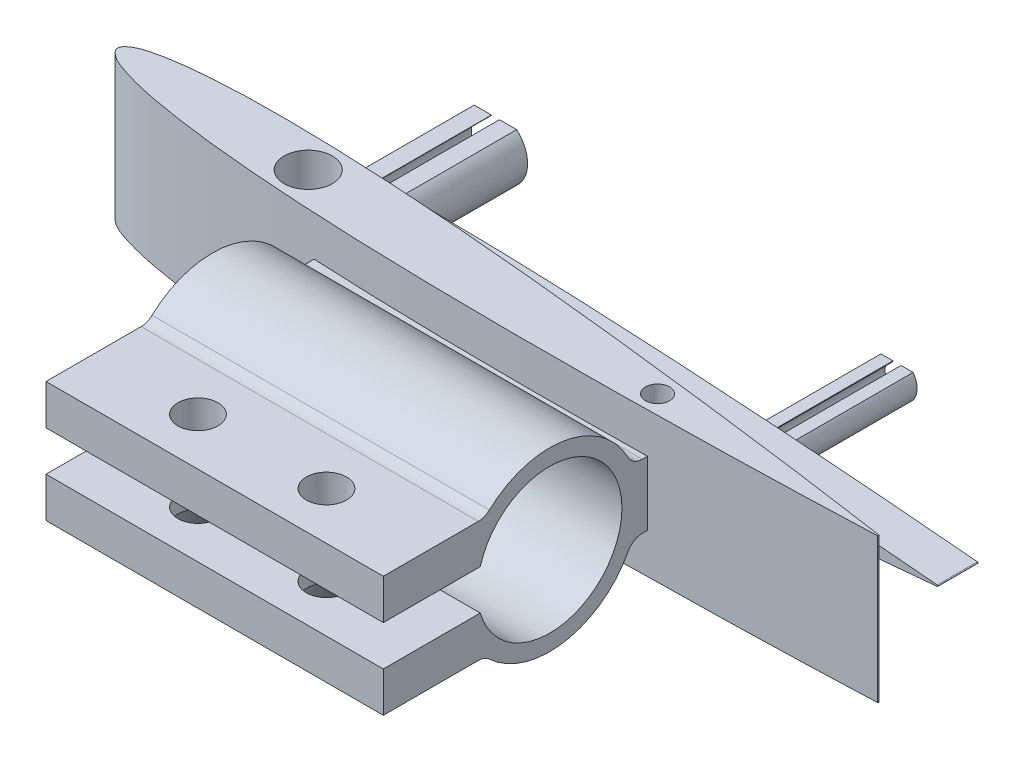
from build123d import *
from build123d.topology import SkipClean

# Parameters (mm, degrees)
CORPOCENTINA_DEPTH             = 5
SCHIZZO2_R                     = 3
FOROLONGHERONE_DEPTH           = 101.288658798
AGGANCIOPERNO_DEPTH            = 15
AGGANCIOLONGHERONE_DEPTH       = 15
AGGANCIOTUBOMOTORE_DEPTH       = 42
RACCORDIAGGANCIOTUBOMOTORE_R   = 2
SCHIZZO7_R                     = 3
CHIUSURAFOROLONGHERONE_DEPTH   = 5
CENTINAORIZZONTALE_DEPTH       = 9
CENTINAORIZZONTALE_DEPTH_BACK  = 9
CHIUSURACENTINAVERTICALE_DEPTH = 2.000000405
SCHIZZO11_R                    = 3
SCHIZZO11_R_2                  = 1.5
FORICENTINAORIZZONTALE_DEPTH   = 18
SCHIZZO13_R                    = 2.5
FORIVITIBASE_DEPTH             = 112.675114745


with BuildPart() as part:
    # Schizzo1 → CorpoCentina (new body)
    with BuildSketch(Plane.XY):
        with BuildLine():
            ThreePointArc((100, 0.084), (100.084, 0), (100, -0.084))
            add(Edge.make_bspline(
                [(100, 0.084), (98.333488815, 0.23674648), (95.001194725, 0.542172689), (88.335559621, 1.11089898), (80.003293356, 1.763610995), (70.002998933, 2.457861693), (60.003104625, 3.061747723), (50.003008601, 3.552139212), (40.002598558, 3.902946494), (31.666961486, 4.025260151), (24.9991546, 3.976933791), (19.997775587, 3.844976398), (14.993363131, 3.592486959), (10.827184065, 3.237651579), (7.489054388, 2.814021367), (4.99359465, 2.403673059), (2.84962634, 1.867925494), (1.165413503, 1.320987252), (-0.664613784, 0), (1.165413503, -1.320987252), (2.84962634, -1.867925494), (4.99359465, -2.403673059), (7.489054388, -2.814021367), (10.827184065, -3.237651579), (14.993363131, -3.592486959), (19.997775587, -3.844976398), (24.9991546, -3.976933791), (31.666961486, -4.025260151), (40.002598558, -3.902946494), (50.003008601, -3.552139212), (60.003104625, -3.061747723), (70.002998933, -2.457861693), (80.003293356, -1.763610995), (88.335559621, -1.11089898), (95.001194725, -0.542172689), (98.333488815, -0.23674648), (100, -0.084)],
                knots=[0, 0, 0, 0, 0.024876293, 0.049741715, 0.099443402, 0.149112224, 0.198750974, 0.248359097, 0.29793737, 0.347491327, 0.37226694, 0.397050924, 0.421859475, 0.446731346, 0.459220451, 0.471790602, 0.484560454, 0.491195112, 0.5, 0.508804888, 0.515439546, 0.528209398, 0.540779549, 0.553268654, 0.578140525, 0.602949076, 0.62773306, 0.652508673, 0.70206263, 0.751640903, 0.801249026, 0.850887776, 0.900556598, 0.950258285, 0.975123707, 1, 1, 1, 1], degree=3))
        make_face()
    extrude(amount=CORPOCENTINA_DEPTH)

    # Schizzo2 → ForoLongherone (cut, through all)
    with BuildSketch(Plane.XY.offset(5)):
        with Locations((25, 0)):
            Circle(SCHIZZO2_R)
    extrude(amount=-FOROLONGHERONE_DEPTH, mode=Mode.SUBTRACT)

    # Schizzo3 → AggancioPerno (add)
    with BuildSketch(Plane(origin=(0, 0, 0), x_dir=(-1, 0, 0), z_dir=(0, 0, -1))):
        with BuildLine():
            Line((-77, 1.5), (-75.5, 1.5))
            Line((-75.5, 1.5), (-75.5, 1.414213562))
            ThreePointArc((-75.5, 1.414213562), (-76.5, 0), (-75.5, -1.414213562))
            Line((-75.5, -1.414213562), (-75.5, -1.5))
            Line((-75.5, -1.5), (-77, -1.5))
            ThreePointArc((-77, -1.5), (-77.5, 0), (-77, 1.5))
        make_face()
        with BuildLine():
            Line((-74.5, 1.5), (-73, 1.5))
            ThreePointArc((-73, 1.5), (-72.5, 0), (-73, -1.5))
            Line((-73, -1.5), (-74.5, -1.5))
            Line((-74.5, -1.5), (-74.5, -1.414213562))
            ThreePointArc((-74.5, -1.414213562), (-73.5, 0), (-74.5, 1.414213562))
            Line((-74.5, 1.414213562), (-74.5, 1.5))
        make_face()
    extrude(amount=AGGANCIOPERNO_DEPTH)

    # Schizzo4 → AggancioLongherone (add)
    with SkipClean():  # the faces are left unmerged after this step: merging them gives an invalid solid
        with BuildSketch(Plane(origin=(0, 0, 0), x_dir=(-1, 0, 0), z_dir=(0, 0, -1))):
            with BuildLine():
                Line((-25.5, -3), (-27.645751311, -3))
                ThreePointArc((-27.645751311, -3), (-29, 0), (-27.645751311, 3))
                Line((-27.645751311, 3), (-25.5, 3))
                Line((-25.5, 3), (-25.5, 2.958039892))
                ThreePointArc((-25.5, 2.958039892), (-28, 0), (-25.5, -2.958039892))
                Line((-25.5, -2.958039892), (-25.5, -3))
            make_face()
            with BuildLine():
                Line((-22.354248689, -3), (-24.5, -3))
                Line((-24.5, -3), (-24.5, -2.958039892))
                ThreePointArc((-24.5, -2.958039892), (-22, 0), (-24.5, 2.958039892))
                Line((-24.5, 2.958039892), (-24.5, 3))
                Line((-24.5, 3), (-22.354248689, 3))
                ThreePointArc((-22.354248689, 3), (-21, 0), (-22.354248689, -3))
            make_face()
        extrude(amount=AGGANCIOLONGHERONE_DEPTH)

    # Schizzo7 → ChiusuraForoLongherone (add)
    with BuildSketch(Plane.XY.offset(5)):
        with Locations((25, 0)):
            Circle(SCHIZZO7_R)
    extrude(amount=-CHIUSURAFOROLONGHERONE_DEPTH)



with BuildPart() as body_2:
    # Schizzo5 → AggancioTuboMotore (new body)
    with BuildSketch(Plane(origin=(30, 0, 0), x_dir=(0, 0, -1), z_dir=(1, 0, 0))):
        with BuildLine():
            Line((-33.893149535, -2.5), (-45.959483945, -2.5))
            Line((-45.959483945, -2.5), (-45.959483945, -7.5))
            Line((-45.959483945, -7.5), (-33.294079772, -7.5))
            ThreePointArc((-33.294079772, -7.5), (-23.18080966, -10.80414027), (-15.000781185, -4.001000595))
            Line((-15.000781185, -4.001000595), (-5, -4.001000595))
            Line((-5, -4.001000595), (-5, 3.998999405))
            Line((-5, 3.998999405), (-15, 3.998999405))
            ThreePointArc((-15, 3.998999405), (-23.179754666, 10.803938425), (-33.294079772, 7.5))
            Line((-33.294079772, 7.5), (-45.959483945, 7.5))
            Line((-45.959483945, 7.5), (-45.959483945, 2.5))
            Line((-45.959483945, 2.5), (-33.893149535, 2.5))
            ThreePointArc((-33.893149535, 2.5), (-16.247341302, 0), (-33.893149535, -2.5))
        make_face()
    extrude(amount=AGGANCIOTUBOMOTORE_DEPTH)

    # RaccordiAggancioTuboMotore
    raccordiagganciotubomotore_edges = [body_2.edges().sort_by_distance(p)[0] for p in [
        (51, 7.5, 33.294079772),
        (51, 3.998999405, 15),
        (51, -4.001000595, 15.000781185),
        (51, -7.5, 33.294079772),
    ]]
    fillet(raccordiagganciotubomotore_edges, radius=RACCORDIAGGANCIOTUBOMOTORE_R)


with BuildPart() as part_1:
    add(part.part)

    add(body_2.part)  # CentinaOrizzontale merges body 2
    # Schizzo9 → CentinaOrizzontale (add, two sides: drawn at the far end of the back side and taken through both)
    with BuildSketch(Plane(origin=(0, 0, 0), x_dir=(1, 0, 0), z_dir=(0, 1, 0)).offset(-CENTINAORIZZONTALE_DEPTH_BACK)):
        with BuildLine():
            ThreePointArc((99.858557, -12.317481), (99.9468385, -12.2379925), (99.86735, -12.149711))
            add(Edge.make_bspline(
                [(99.858557, -12.317481), (98.186335529, -12.382799486), (94.842623554, -12.513407907), (88.156358689, -12.732503273), (79.801351417, -12.948243336), (69.778427828, -13.118167193), (59.760633088, -13.197871686), (49.748576791, -13.164225594), (39.743512062, -12.991172359), (31.412897477, -12.677063929), (24.756757786, -12.279837584), (19.769139142, -11.886309686), (14.784799254, -11.372255664), (10.642900429, -10.799865186), (7.331516604, -10.202111263), (4.860952629, -9.661723247), (2.747961354, -9.014503598), (1.094681423, -8.380169548), (-0.663703039, -6.965217072), (1.232951209, -5.741816187), (2.943480728, -5.283772896), (5.112549449, -4.860964916), (7.626065563, -4.581782103), (10.981791234, -4.333436791), (15.160831505, -4.197128898), (20.171599779, -4.206895468), (25.173030767, -4.336870678), (31.834228682, -4.637577347), (40.152040526, -5.195977321), (50.120385579, -6.069683549), (60.081111596, -7.08276874), (70.035696464, -8.209180699), (79.985951725, -9.425853893), (88.272638372, -10.513750221), (94.89937396, -11.430548855), (98.211116676, -11.909955353), (99.86735, -12.149711)],
                knots=[0, 0, 0, 0, 0.024876294, 0.049741713, 0.099443402, 0.149112221, 0.198750972, 0.248359097, 0.297937367, 0.347491326, 0.372266938, 0.397050921, 0.421859472, 0.446731344, 0.45922045, 0.4717906, 0.484560455, 0.491195109, 0.499999998, 0.508804884, 0.515439541, 0.528209399, 0.540779546, 0.553268653, 0.578140521, 0.602949076, 0.627733057, 0.65250867, 0.702062628, 0.751640899, 0.801249022, 0.850887773, 0.900556594, 0.950258282, 0.975123705, 1, 1, 1, 1], degree=3))
        make_face()
    extrude(amount=CENTINAORIZZONTALE_DEPTH + CENTINAORIZZONTALE_DEPTH_BACK)

    # ChiusuraCentinaVerticale: read off the stored shape, not the designer's step
    # ChiusuraCentinaVerticale outline → ChiusuraCentinaVerticale (add)
    with BuildSketch(Plane.XY.offset(5)):
        with BuildLine():
            Line((6, -2.560425941), (6, 2.560425941))
            add(Edge.make_bspline(
                [(6, 2.560425941), (5.667221496, 2.501569079), (4.487639455, 2.277241963), (2.84962634, 1.867925494), (1.165413503, 1.320987252), (-0.664613784, 0), (1.165413503, -1.320987252), (2.84962634, -1.867925494), (4.487639455, -2.277241963), (5.667221496, -2.501569079), (6, -2.560425941)],
                knots=[0.466766153, 0.466766153, 0.466766153, 0.466766153, 0.471790602, 0.484560454, 0.491195112, 0.5, 0.508804888, 0.515439546, 0.528209398, 0.533233847, 0.533233847, 0.533233847, 0.533233847], degree=3))
        make_face()
    extrude(amount=CHIUSURACENTINAVERTICALE_DEPTH)

    # Schizzo11 → ForiCentinaOrizzontale (cut)
    with BuildSketch(Plane(origin=(0, 9, 0), x_dir=(1, 0, 0), z_dir=(0, 1, 0))):
        with Locations(Location((25.000000001, -8.310194561, 0), (0, 0, 270))):
            Circle(SCHIZZO11_R)
        with Locations(Location((70.902696998, -10.715853155, 0), (0, 0, 270))):
            Circle(SCHIZZO11_R_2)
    extrude(amount=-FORICENTINAORIZZONTALE_DEPTH, mode=Mode.SUBTRACT)

    # Schizzo13 → ForiVitiBase (cut, through all)
    with BuildSketch(Plane.XZ.offset(7.5)):
        with Locations(Location((59, 40.040472461, 0), (0, 0, 270))):
            Circle(SCHIZZO13_R)
        with Locations(Location((43, 40.040472461, 0), (0, 0, 270))):
            Circle(SCHIZZO13_R)
    extrude(amount=-FORIVITIBASE_DEPTH, mode=Mode.SUBTRACT)

    # Schizzo14 → SvasaturaViteSinistra (revolve, cut)
    with BuildSketch(Plane(origin=(59, 0, 0), x_dir=(0, 0, -1), z_dir=(1, 0, 0))):
        Polygon((-35.540472461, -7.5), (-40.040472461, -7.5), (-40.040472461, -4.5), (-37.540472461, -4.5), align=None)
    svasaturavitesinistra = revolve(axis=Axis((59, -7.5, 40.040472461), (0, 1, 0)), mode=Mode.SUBTRACT)

    # SvasaturaViteDestra: SvasaturaViteSinistra across plane
    add(svasaturavitesinistra.mirror(Plane(origin=(51, 0, 0), x_dir=(0, 0, 1), z_dir=(1, 0, 0))), mode=Mode.SUBTRACT)


solid = part_1.part
